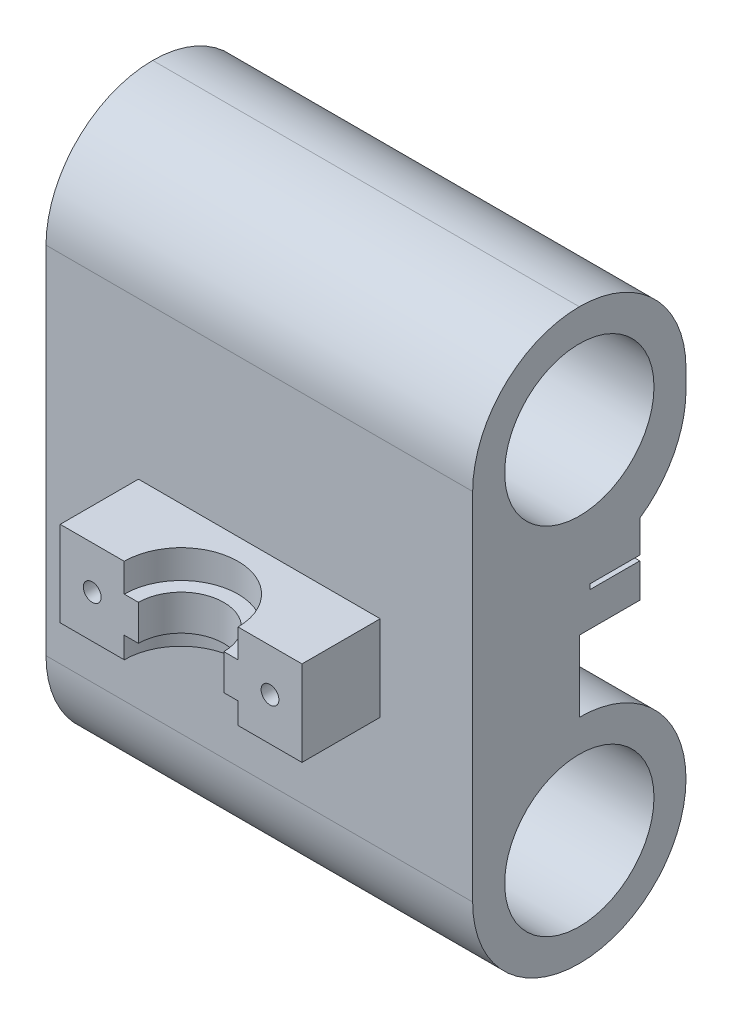
from build123d import *

# Parameters (mm, degrees)
SKETCH_1_R               = 10.5
EXTRUDE_2_DEPTH          = 60
FILLET_1_R               = 15
FILLET_5_R               = 15
FILLET_3_R               = 15
SKETCH_2_W               = 34
SKETCH_2_H               = 12
EXTRUDE_3_DEPTH          = 11
CUT_EXTRUDE_1_DEPTH      = 12
CUT_EXTRUDE_2_DEPTH      = 80.680612447
CUT_EXTRUDE_2_DEPTH_BACK = 4
CUT_EXTRUDE_3_DEPTH      = 84.072257704
CUT_EXTRUDE_3_DEPTH_BACK = 3
SKETCH_6_R               = 1.25
CUT_EXTRUDE_4_DEPTH      = 11
FILLET_10_R              = 15
FILLET_11_R              = 15
FILLET_13_R              = 15
SKETCH_9_W               = 1.1
SKETCH_9_H               = 0.9
CUT_EXTRUDE_6_DEPTH      = 7
SKETCH_11_W              = 1.1
SKETCH_11_H              = 0.9
CUT_EXTRUDE_7_DEPTH      = 7


# Some blends are built 0.0001 mm under size
with BuildPart() as part:
    # Эскиз1 → Бобышка-Вытянуть2 (new body)
    with BuildSketch(Plane(origin=(0, 0, 0), x_dir=(0, 0, -1), z_dir=(1, 0, 0))):
        Polygon((0, 0), (0, 80), (30, 80), (30, 50), (23.5, 50), (23.5, 45.5), (16.5, 45.5), (16.5, 44.8), (23.5, 44.8), (23.5, 40), (16.5, 40), (15, 40), (15, 30), (30, 30), (30, 0), align=None)
        with Locations((15, 15)):
            Circle(SKETCH_1_R, mode=Mode.SUBTRACT)
        with Locations((15, 65)):
            Circle(SKETCH_1_R, mode=Mode.SUBTRACT)
    extrude(amount=EXTRUDE_2_DEPTH)

    # Скругление1
    fillet_1_edges = [part.edges().sort_by_distance(p)[0] for p in [
        (30, 30, -30),
    ]]
    fillet(fillet_1_edges, radius=FILLET_1_R - 0.0001)  # a hair under: the kernel refuses the full size

    # Скругление5
    fillet_5_edges = [part.edges().sort_by_distance(p)[0] for p in [
        (30, 80, -30),
    ]]
    fillet(fillet_5_edges, radius=FILLET_5_R)

    # Скругление3
    fillet_3_edges = [part.edges().sort_by_distance(p)[0] for p in [
        (30, 0, -30),
    ]]
    fillet(fillet_3_edges, radius=FILLET_3_R)

    # Эскиз2 → Бобышка-Вытянуть3 (add)
    with BuildSketch(Plane.XY):
        with Locations((30, 37)):
            Rectangle(SKETCH_2_W, SKETCH_2_H)
    extrude(amount=EXTRUDE_3_DEPTH)

    # Эскиз3 → Вырез-Вытянуть1 (cut)
    with BuildSketch(Plane(origin=(0, 43, 0), x_dir=(1, 0, 0), z_dir=(0, 1, 0))):
        with BuildLine():
            ThreePointArc((36, -11), (30, -5), (24, -11))
            Line((24, -11), (36, -11))
        make_face()
    extrude(amount=-CUT_EXTRUDE_1_DEPTH, mode=Mode.SUBTRACT)

    # Эскиз4 → Вырез-Вытянуть2 (cut, two sides: drawn at the far end of the back side and taken through both)
    with BuildSketch(Plane(origin=(0, 43, 0), x_dir=(1, 0, 0), z_dir=(0, 1, 0)).offset(-CUT_EXTRUDE_2_DEPTH_BACK)):
        with BuildLine():
            Line((38, -132.803398875), (38, -11))
            ThreePointArc((38, -11), (30, -3), (22, -11))
            Line((22, -11), (22, -132.803398875))
            Line((22, -132.803398875), (22, -376.410196625))
            Line((22, -376.410196625), (38, -376.410196625))
            Line((38, -376.410196625), (38, -132.803398875))
        make_face()
    extrude(amount=CUT_EXTRUDE_2_DEPTH + CUT_EXTRUDE_2_DEPTH_BACK, mode=Mode.SUBTRACT)

    # Эскиз5 → Вырез-Вытянуть3 (cut, two sides: drawn at the far end of the back side and taken through both)
    with BuildSketch(Plane(origin=(0, 31, 0), x_dir=(-1, 0, 0), z_dir=(0, -1, 0)).offset(-CUT_EXTRUDE_3_DEPTH_BACK)):
        with BuildLine():
            Line((-22, -132.803398875), (-22, -11))
            ThreePointArc((-22, -11), (-30, -3), (-38, -11))
            Line((-38, -11), (-38, -132.803398875))
            Line((-38, -132.803398875), (-38, -376.410196625))
            Line((-38, -376.410196625), (-22, -376.410196625))
            Line((-22, -376.410196625), (-22, -132.803398875))
        make_face()
    extrude(amount=CUT_EXTRUDE_3_DEPTH + CUT_EXTRUDE_3_DEPTH_BACK, mode=Mode.SUBTRACT)

    # Эскиз6 → Вырез-Вытянуть4 (cut)
    with BuildSketch(Plane.XY.offset(11)):
        with Locations((17.5, 37)):
            Circle(SKETCH_6_R)
        with Locations((42.5, 37)):
            Circle(SKETCH_6_R)
    extrude(amount=-CUT_EXTRUDE_4_DEPTH, mode=Mode.SUBTRACT)

    # Скругление10
    fillet_10_edges = [part.edges().sort_by_distance(p)[0] for p in [
        (30, 80, 0),
    ]]
    fillet(fillet_10_edges, radius=FILLET_10_R - 0.0001)  # a hair under: the kernel refuses the full size

    # Скругление11
    fillet_11_edges = [part.edges().sort_by_distance(p)[0] for p in [
        (30, 0, 0),
    ]]
    fillet(fillet_11_edges, radius=FILLET_11_R - 0.0001)  # a hair under: the kernel refuses the full size

    # Скругление13
    # the kernel refuses this fillet: 15 mm, written as the material it takes off along each edge
    with BuildSketch(Plane(origin=(-30.898017736, 50, -30), x_dir=(0, 1, 0), z_dir=(1, 0, 0))) as fillet_13_piece_1:
        with BuildLine():
            CenterArc((12.359207094, 15), FILLET_13_R, 214.518107841, 55.481892159)
            Line((0, 6.5), (-0.247184142, 6.33))
            ThreePointArc((-0.247184142, 6.33), (-0.3, 3.25), (-0.3, 0))
            Line((-0.3, 0), (0, -0.3))
            Line((0, -0.3), (12.359207094, -0.3))
            Line((12.359207094, -0.3), (12.359207094, 0))
        make_face()
    extrude(amount=121.796035472, mode=Mode.SUBTRACT)

    # Эскиз9 → Вырез-Вытянуть6 (cut)
    with BuildSketch(Plane(origin=(0, 0, -23.5), x_dir=(-1, 0, 0), z_dir=(0, 0, -1))):
        with Locations((-58.6, 44.35)):
            Rectangle(SKETCH_9_W, SKETCH_9_H)
        with Locations((-56.65, 44.35)):
            Rectangle(SKETCH_9_W, SKETCH_9_H)
        with Locations((-54.7, 44.35)):
            Rectangle(SKETCH_9_W, SKETCH_9_H)
        with Locations((-52.75, 44.35)):
            Rectangle(SKETCH_9_W, SKETCH_9_H)
        with Locations((-50.8, 44.35)):
            Rectangle(SKETCH_9_W, SKETCH_9_H)
        with Locations((-48.85, 44.35)):
            Rectangle(SKETCH_9_W, SKETCH_9_H)
        with Locations((-46.9, 44.35)):
            Rectangle(SKETCH_9_W, SKETCH_9_H)
        with Locations((-44.95, 44.35)):
            Rectangle(SKETCH_9_W, SKETCH_9_H)
        with Locations((-43, 44.35)):
            Rectangle(SKETCH_9_W, SKETCH_9_H)
        with Locations((-41.05, 44.35)):
            Rectangle(SKETCH_9_W, SKETCH_9_H)
        with Locations((-39.1, 44.35)):
            Rectangle(SKETCH_9_W, SKETCH_9_H)
        with Locations((-37.15, 44.35)):
            Rectangle(SKETCH_9_W, SKETCH_9_H)
    extrude(amount=-CUT_EXTRUDE_6_DEPTH, mode=Mode.SUBTRACT)

    # Эскиз11 → Вырез-Вытянуть7 (cut)
    with BuildSketch(Plane(origin=(0, 0, -23.5), x_dir=(-1, 0, 0), z_dir=(0, 0, -1))):
        with Locations((-1.4, 44.35)):
            Rectangle(SKETCH_11_W, SKETCH_11_H)
        with Locations((-3.35, 44.35)):
            Rectangle(SKETCH_11_W, SKETCH_11_H)
        with Locations((-5.3, 44.35)):
            Rectangle(SKETCH_11_W, SKETCH_11_H)
        with Locations((-7.25, 44.35)):
            Rectangle(SKETCH_11_W, SKETCH_11_H)
        with Locations((-9.2, 44.35)):
            Rectangle(SKETCH_11_W, SKETCH_11_H)
        with Locations((-11.15, 44.35)):
            Rectangle(SKETCH_11_W, SKETCH_11_H)
        with Locations((-13.1, 44.35)):
            Rectangle(SKETCH_11_W, SKETCH_11_H)
        with Locations((-15.05, 44.35)):
            Rectangle(SKETCH_11_W, SKETCH_11_H)
        with Locations((-17, 44.35)):
            Rectangle(SKETCH_11_W, SKETCH_11_H)
        with Locations((-18.95, 44.35)):
            Rectangle(SKETCH_11_W, SKETCH_11_H)
        with Locations((-20.9, 44.35)):
            Rectangle(SKETCH_11_W, SKETCH_11_H)
        with Locations((-22.85, 44.35)):
            Rectangle(SKETCH_11_W, SKETCH_11_H)
    extrude(amount=-CUT_EXTRUDE_7_DEPTH, mode=Mode.SUBTRACT)


solid = part.part
